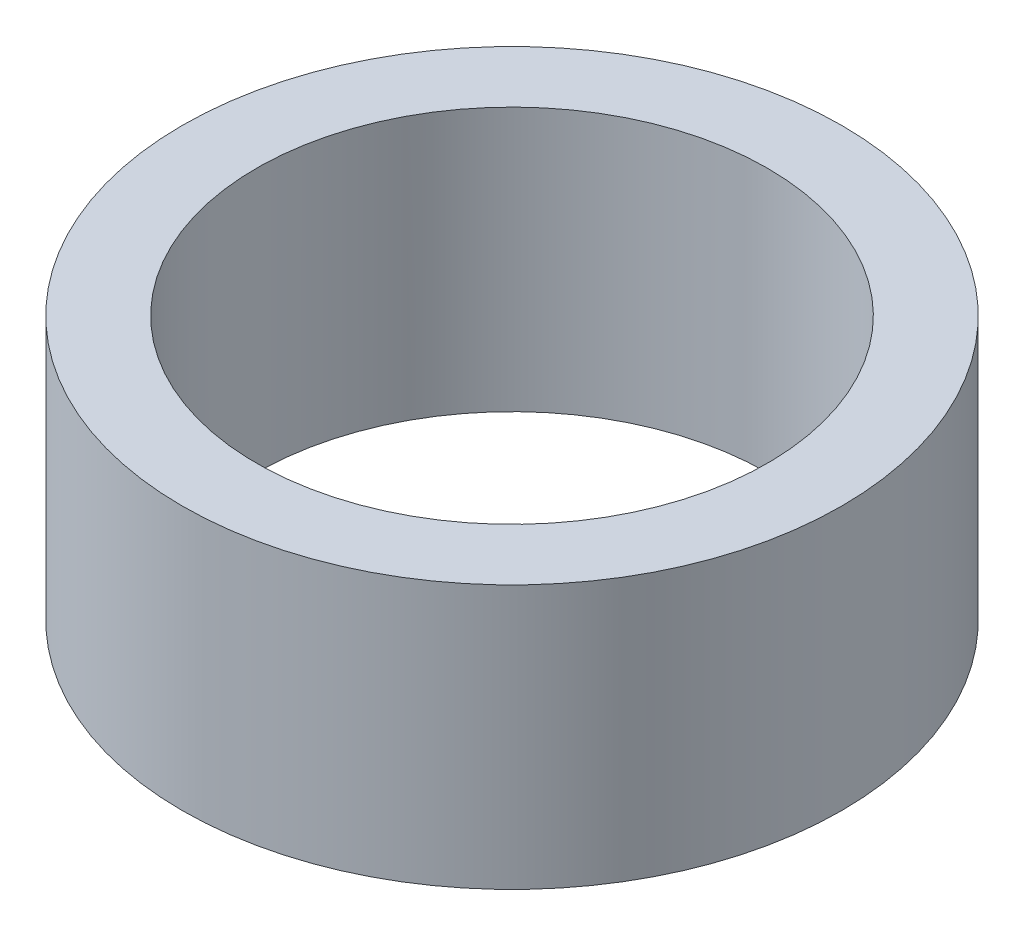
from build123d import *

# Parameters (mm, degrees)
SKETCH1_R           = 10
BOSS_EXTRUDE1_DEPTH = 8


with BuildPart() as part:
    # Sketch1 → Boss-Extrude1 (new body)
    with BuildSketch(Plane(origin=(0, 0, 0), x_dir=(1, 0, 0), z_dir=(0, 1, 0))):
        Circle(SKETCH1_R)
        with BuildLine():
            ThreePointArc((-7.75, 0), (0, 7.75), (7.75, 0))
            ThreePointArc((7.75, 0), (0, -7.75), (-7.75, 0))
        make_face(mode=Mode.SUBTRACT)
    extrude(amount=BOSS_EXTRUDE1_DEPTH)


solid = part.part
